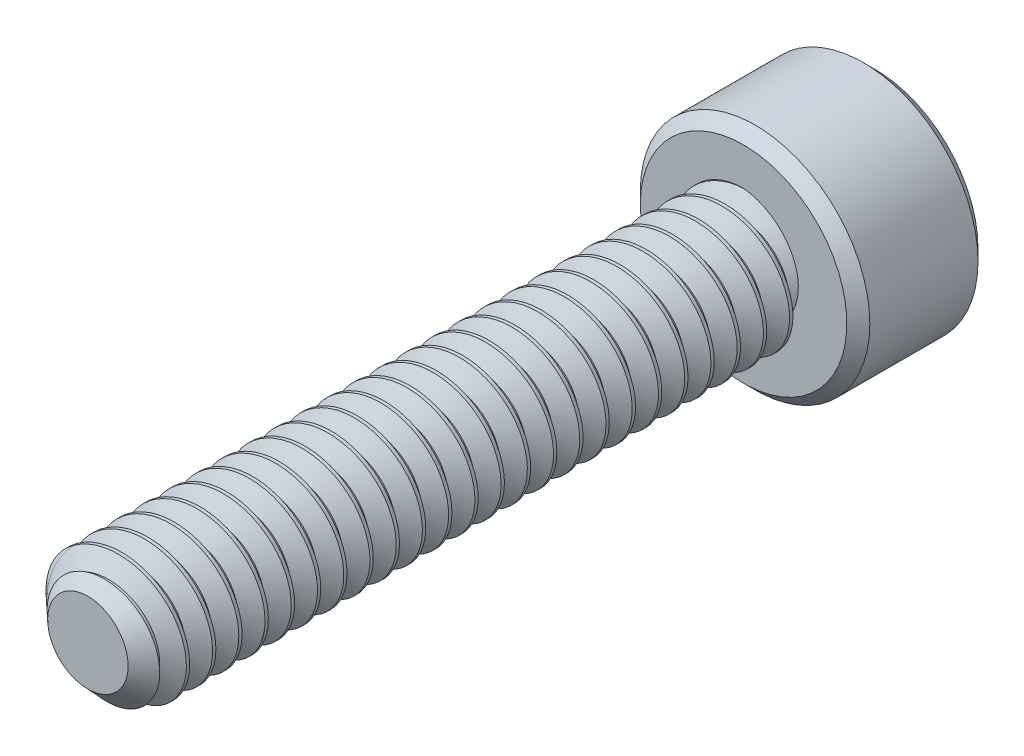
from build123d import *

# Parameters (mm, degrees)
SKETCH1_R          = 2
EXTRUDE1_DEPTH     = 20
CUT_SWEEP1_PITCH   = 0.8
SKETCH6_R          = 3.5
EXTRUDE2_DEPTH     = 4
CUT_EXTRUDE1_DEPTH = 2.25
CHAMFER1_SIZE      = 0.35


with BuildPart() as part:
    # Sketch1 → Extrude1 (new body)
    with BuildSketch(Plane.XY):
        Circle(SKETCH1_R)
    extrude(amount=-EXTRUDE1_DEPTH)

    # Cut-Sweep1: the profile of Sketch3 profile screwed along a right-hand helix of 26 turns, 6 arcs to a turn; built about Z, then put on its axis
    cut_sweep1_z = Axis((0, 0, 0), (0, 0, 1))
    cut_sweep1_corners = [(2.0003, 0, -0.700173205), (1.480384758, 0, -0.4), (1.480384758, 0, -0.3), (2.0003, 0, 0.000173205)]
    with BuildLine(mode=Mode.PRIVATE) as cut_sweep1_profile:
        Line(cut_sweep1_corners[0], cut_sweep1_corners[1])
        Line(cut_sweep1_corners[1], cut_sweep1_corners[2])
        Line(cut_sweep1_corners[2], cut_sweep1_corners[3])
        Line(cut_sweep1_corners[3], cut_sweep1_corners[0])
    cut_sweep1_cap = Face(cut_sweep1_profile.wire())
    cut_sweep1_turn_angles = [0, 30, 60, 90, 120, 150, 180, 210, 240, 270, 300, 330, 360]
    cut_sweep1_turn_weights = [1, 0.8660254037844387, 1, 0.8660254037844387, 1, 0.8660254037844387, 1, 0.8660254037844387, 1, 0.8660254037844387, 1, 0.8660254037844387, 1]
    cut_sweep1_turn_rails = [Edge.make_bspline([Vector(p[0], p[1], 0).rotate(cut_sweep1_z, cut_sweep1_turn_angles[k]) / cut_sweep1_turn_weights[k] + Vector(0, 0, p[2] + CUT_SWEEP1_PITCH * cut_sweep1_turn_angles[k] / 360) for k in range(13)], [0, 0, 0, 1, 1, 2, 2, 3, 3, 4, 4, 5, 5, 6, 6, 6], 2, cut_sweep1_turn_weights) for p in cut_sweep1_corners]
    cut_sweep1_turn_sides = [Face.make_surface_from_curves(cut_sweep1_turn_rails[p[0]], cut_sweep1_turn_rails[p[1]]) for p in [(0, 1), (1, 2), (2, 3), (3, 0)]]
    cut_sweep1 = Plane(origin=(0, 0, 0), x_dir=(0, 1, 0), z_dir=(0, 0, -1)) * Solid(Shell([*[p.moved(Location((0, 0, CUT_SWEEP1_PITCH * i))) for i in range(26) for p in cut_sweep1_turn_sides], cut_sweep1_cap, cut_sweep1_cap.rotate(cut_sweep1_z, 9360).moved(Location((0, 0, CUT_SWEEP1_PITCH * 9360 / 360)))]))
    add(cut_sweep1, mode=Mode.SUBTRACT)

    # Sketch4 → Cut-Revolve1 (revolve, cut)
    with BuildSketch(Plane(origin=(0, 0, 0), x_dir=(0, 0, -1), z_dir=(1, 0, 0)), mode=Mode.PRIVATE) as cut_revolve1_sk:
        Polygon((0.721407884, 2), (0, 1.226384758), (0, 2), align=None)
    revolve(cut_revolve1_sk.sketch.rotate(Axis((0, 0, 0), (0, 0, -1)), 279.239351729), axis=Axis((0, 0, 0), (0, 0, -1)), mode=Mode.SUBTRACT)

    # Sketch6 → Extrude2 (add)
    with BuildSketch(Plane(origin=(0, 0, -20), x_dir=(-1, 0, 0), z_dir=(0, 0, -1))):
        Circle(SKETCH6_R)
    extrude(amount=EXTRUDE2_DEPTH)

    # Sketch7 → Cut-Extrude1 (cut)
    with BuildSketch(Plane(origin=(0, 0, -24), x_dir=(-1, 0, 0), z_dir=(0, 0, -1))):
        Polygon((0, 1.732050808), (-1.5, 0.866025404), (-1.5, -0.866025404), (0, -1.732050808), (1.5, -0.866025404), (1.5, 0.866025404), align=None)
    extrude(amount=-CUT_EXTRUDE1_DEPTH, mode=Mode.SUBTRACT)

    # Cut-Extrude2 cone 1 section (through the dimple's axis) → Cut-Extrude2 (revolve, cut)
    with BuildSketch(Plane(origin=(0, 0, -24), x_dir=(0, 1, 0), z_dir=(1, 0, 0))):
        Polygon((0, 0), (1.732050808, 0), (0, 1.732050808), align=None)
    revolve(axis=Axis((0, 0, -24), (0, 0, 1)), mode=Mode.SUBTRACT)

    # Chamfer1
    chamfer1_edges = [part.edges().sort_by_distance(p)[0] for p in [
        (3.5, 0, -20),
        (3.5, 0, -24),
    ]]
    chamfer(chamfer1_edges, length=CHAMFER1_SIZE)


solid = part.part
